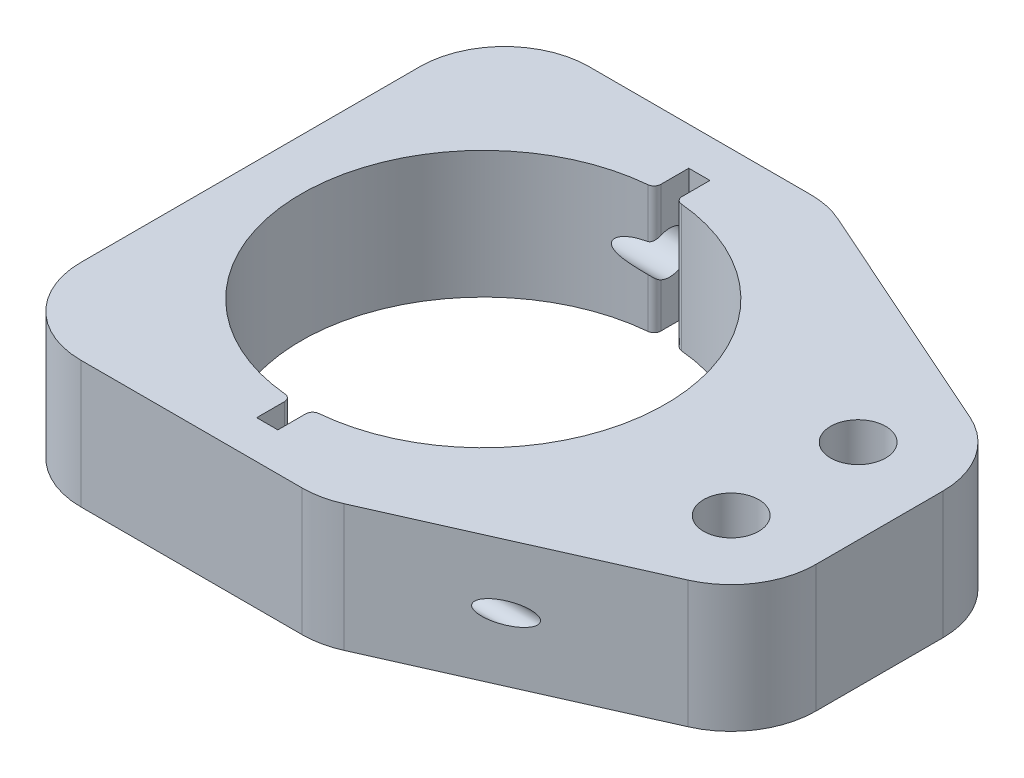
from build123d import *

# Parameters (mm, degrees)
SKETCH1_W           = 74.25
SKETCH1_H           = 60
SKETCH1_R           = 3.25
BOSS_EXTRUDE1_DEPTH = 15
SKETCH2_R           = 1.25
CUT_EXTRUDE1_DEPTH  = 82.474305766
CUT_EXTRUDE2_REACH  = 83.474
SKETCH3_R           = 2.5
CUT_EXTRUDE3_DEPTH  = 58.537487806
FILLET1_R           = 10
FILLET2_R           = 0.8


with BuildPart() as part:
    # Sketch1 → Boss-Extrude1 (new body)
    with BuildSketch(Plane(origin=(0, 0, 0), x_dir=(1, 0, 0), z_dir=(0, 1, 0))):
        with Locations((9.625, 0)):
            Rectangle(SKETCH1_W, SKETCH1_H)
        with Locations(Location((36.75, 7.493, 0), (0, 0, 270))):
            Circle(SKETCH1_R, mode=Mode.SUBTRACT)
        with Locations(Location((36.75, -7.493, 0), (0, 0, 270))):
            Circle(SKETCH1_R, mode=Mode.SUBTRACT)
        with BuildLine():
            Line((-1.25, 21.463632032), (-1.25, 25.5))
            Line((-1.25, 25.5), (1.25, 25.5))
            Line((1.25, 25.5), (1.25, 21.463632032))
            ThreePointArc((1.25, 21.463632032), (21.5, 0), (1.25, -21.463632032))
            Line((1.25, -21.463632032), (1.25, -25.5))
            Line((1.25, -25.5), (-1.25, -25.5))
            Line((-1.25, -25.5), (-1.25, -21.463632032))
            ThreePointArc((-1.25, -21.463632032), (-21.5, 0), (-1.25, 21.463632032))
        make_face(mode=Mode.SUBTRACT)
    extrude(amount=BOSS_EXTRUDE1_DEPTH)

    # Sketch2 → Cut-Extrude1 (cut, through all)
    with BuildSketch(Plane.ZY.offset(27.5)):
        with Locations((-23.25, 7.5)):
            Circle(SKETCH2_R)
        with Locations((23.25, 7.5)):
            Circle(SKETCH2_R)
    extrude(amount=-CUT_EXTRUDE1_DEPTH, mode=Mode.SUBTRACT)

    # Cut-Extrude2: up to this face of the body (flat: up to its plane)
    cut_extrude2_end = Plane(part.part.faces().sort_by_distance((-1.25, 7.5, -21.618967883))[0])
    # Sketch3 → Cut-Extrude2 (cut, up to the picked face)
    with BuildSketch(Plane.ZY.offset(27.5), mode=Mode.PRIVATE) as cut_extrude2_sk1:
        with Locations((-23.25, 7.5)):
            Circle(SKETCH3_R)
    cut_extrude2_tool1 = split(extrude(cut_extrude2_sk1.sketch, amount=-CUT_EXTRUDE2_REACH, mode=Mode.PRIVATE), bisect_by=cut_extrude2_end, keep=Keep.BOTH, mode=Mode.PRIVATE)
    # Sketch3 → Cut-Extrude2 (cut, up to the picked face)
    with BuildSketch(Plane.ZY.offset(27.5), mode=Mode.PRIVATE) as cut_extrude2_sk2:
        with Locations((23.25, 7.5)):
            Circle(SKETCH3_R)
    cut_extrude2_tool2 = split(extrude(cut_extrude2_sk2.sketch, amount=-CUT_EXTRUDE2_REACH, mode=Mode.PRIVATE), bisect_by=cut_extrude2_end, keep=Keep.BOTH, mode=Mode.PRIVATE)
    add(cut_extrude2_tool1.solids().sort_by(Axis((-27.5, 7.5, -23.25), (1, 0, 0)))[0], mode=Mode.SUBTRACT)
    add(cut_extrude2_tool2.solids().sort_by(Axis((-27.5, 7.5, 23.25), (1, 0, 0)))[0], mode=Mode.SUBTRACT)

    # Sketch4 → Cut-Extrude3 (cut, through all)
    with BuildSketch(Plane(origin=(0, 15, 0), x_dir=(1, 0, 0), z_dir=(0, 1, 0))):
        Polygon((10.75, -30), (46.75, -14), (46.75, -30), align=None)
    cut_extrude3 = extrude(amount=-CUT_EXTRUDE3_DEPTH, mode=Mode.SUBTRACT)

    # Mirror1: Cut-Extrude3 across plane
    add(cut_extrude3.mirror(Plane.XY), mode=Mode.SUBTRACT)

    # Fillet1
    # the kernel refuses this fillet: 10 mm, written as the material it takes off along each edge
    with BuildSketch(Plane(origin=(46.75, 31.246827227, -14), x_dir=(-0.9138115486202572, 0, -0.4061384660534477), z_dir=(0, -1, 0))) as fillet1_piece_1:
        with BuildLine():
            CenterArc((FILLET1_R * 0.649873089088, -FILLET1_R), FILLET1_R, 90, 66.037511025)
            Line((-FILLET1_R * 0.263938459532, -FILLET1_R * 0.593861533947), (0, 0))
            Line((0, 0), (FILLET1_R * 0.649873089088, 0))
        make_face()
    extrude(amount=47.493654454, mode=Mode.SUBTRACT)
    with BuildSketch(Plane(origin=(10.75, 20.305361261, -30), x_dir=(-1, 0, 0), z_dir=(0, -1, 0)), Plane(origin=(10.75, 20.305361261, 30), x_dir=(0.9138115486202572, 0, -0.4061384660534476), z_dir=(0, -1, 0))) as fillet1_piece_2:
        with BuildLine():
            CenterArc((FILLET1_R * 0.212214450449, -FILLET1_R), FILLET1_R, 90, 23.962488975)
            Line((-FILLET1_R * 0.193924015604, -FILLET1_R * 0.0861884513797), (0, 0))
            Line((0, 0), (FILLET1_R * 0.212214450449, 0))
        make_face()
    extrude(amount=25.610722522, mode=Mode.SUBTRACT)
    with BuildSketch(Plane(origin=(-27.5, -25, 30), x_dir=(0, 0, -1), z_dir=(0, 1, 0)), Plane(origin=(-27.5, -25, -30), x_dir=(1, 0, 0), z_dir=(0, 1, 0))) as fillet1_piece_3:
        with BuildLine():
            CenterArc((FILLET1_R, -FILLET1_R), FILLET1_R, 90, 90)
            Line((0, -FILLET1_R), (0, 0))
            Line((0, 0), (FILLET1_R, 0))
        make_face()
    extrude(amount=65, mode=Mode.SUBTRACT)
    with BuildSketch(Plane(origin=(46.75, 31.246827227, 14), x_dir=(-0.9138115486202572, 0, 0.4061384660534477), z_dir=(0, -1, 0))) as fillet1_piece_4:
        with BuildLine():
            CenterArc((FILLET1_R * 0.649873089088, FILLET1_R), FILLET1_R, 203.962488975, 66.037511025)
            Line((-FILLET1_R * 0.263938459532, FILLET1_R * 0.593861533947), (0, 0))
            Line((0, 0), (FILLET1_R * 0.649873089088, 0))
        make_face()
    extrude(amount=47.493654454, mode=Mode.SUBTRACT)

    # Fillet2
    # the kernel refuses this fillet: 0.8 mm, written as the material it takes off along each edge
    with BuildSketch(Plane(origin=(1.25, -1.854853982, 21.463632032), x_dir=(0.9971801734895888, 0, -0.07504466402932025), z_dir=(0, 1, 0))) as fillet2_piece_1:
        with BuildLine():
            CenterArc((0.742065381, -0.799885177), FILLET2_R, 90.970759103, 84.725452299)
            Line((-0.055678758, -0.739849446), (0, 0))
            ThreePointArc((0, 0), (0.364255838, -0.003085857), (0.728511676, 0))
        make_face()
    extrude(amount=18.709707964, mode=Mode.SUBTRACT)
    with BuildSketch(Plane(origin=(-1.25, -1.854853982, 21.463632032), x_dir=(-0.9971801734895881, 0, -0.07504466402932955), z_dir=(0, 1, 0)), Plane(origin=(-1.25, 7.394114137, 21.463632032), x_dir=(-0.9971801734895881, 0, -0.07504466402932955), z_dir=(0, 1, 0))) as fillet2_piece_2:
        with BuildLine():
            CenterArc((0.742065381, 0.799885177), FILLET2_R, 184.303788597, 84.725452299)
            Line((-0.055678758, 0.739849446), (0, 0))
            ThreePointArc((0, 0), (0.364255838, 0.003085857), (0.728511676, 0))
        make_face()
    extrude(amount=9.460739845, mode=Mode.SUBTRACT)
    with BuildSketch(Plane(origin=(-1.25, 7.394114137, -21.463632032), x_dir=(-0.9971801734895888, 0, 0.07504466402932025), z_dir=(0, 1, 0))) as fillet2_piece_3:
        with BuildLine():
            CenterArc((0.742065381, -0.799885177), FILLET2_R, 90.970759103, 84.725452299)
            Line((-0.055678758, -0.739849446), (0, 0))
            ThreePointArc((0, 0), (0.364255838, -0.003085857), (0.728511676, 0))
        make_face()
    extrude(amount=9.460739845, mode=Mode.SUBTRACT)
    with BuildSketch(Plane(origin=(-1.25, -1.854853982, -21.463632032), x_dir=(0, 0, -1), z_dir=(0, 1, 0))) as fillet2_piece_4:
        with BuildLine():
            CenterArc((0.741941593, 0.8), FILLET2_R, 185.274547701, 84.725452299)
            ThreePointArc((-0.054670914, 0.726457399), (-0.024258302, 0.363460277), (0, 0))
            Line((0, 0), (0.741941593, 0))
        make_face()
    extrude(amount=9.460739845, mode=Mode.SUBTRACT)
    with BuildSketch(Plane(origin=(1.25, -1.854853982, -21.463632032), x_dir=(0, 0, -1), z_dir=(0, 1, 0))) as fillet2_piece_5:
        with BuildLine():
            CenterArc((0.741941593, -0.8), FILLET2_R, 90, 84.725452299)
            ThreePointArc((-0.054670914, -0.726457399), (-0.024258302, -0.363460277), (0, 0))
            Line((0, 0), (0.741941593, 0))
        make_face()
    extrude(amount=18.709707964, mode=Mode.SUBTRACT)


solid = part.part
